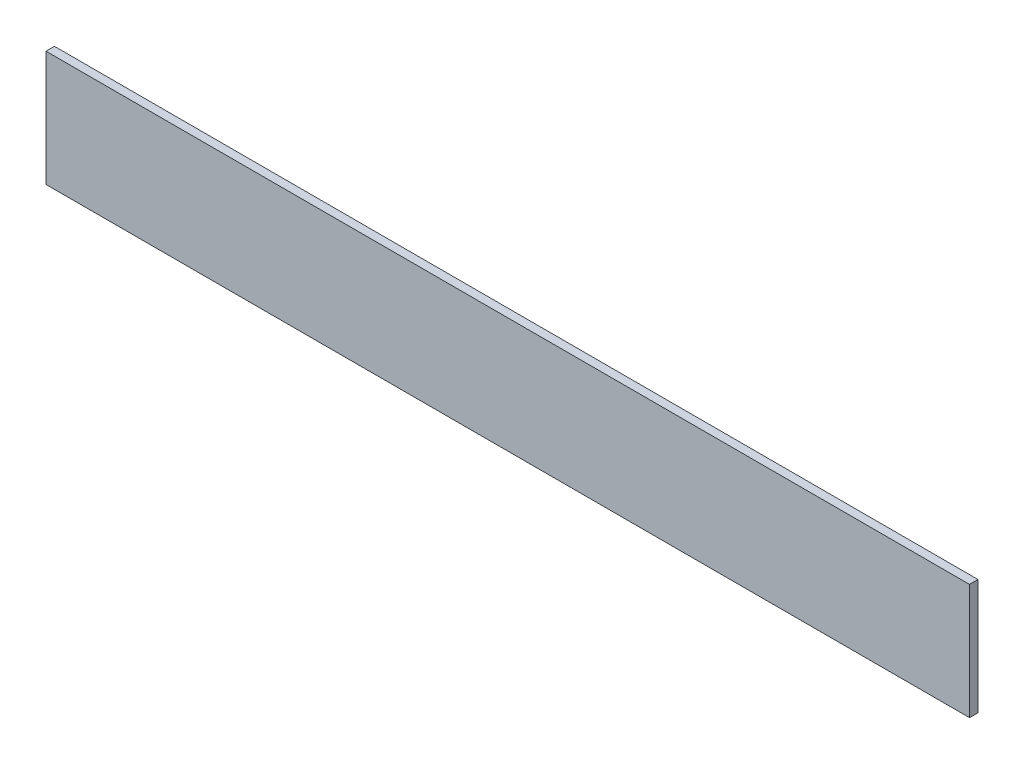
from build123d import *

# Parameters (mm, degrees)
SKETCH1_W           = 609.6
SKETCH1_H           = 76.2
BOSS_EXTRUDE1_DEPTH = 5.588


with BuildPart() as part:
    # Sketch1 → Boss-Extrude1 (new body)
    with BuildSketch(Plane.XY):
        with Locations((222.25, 19.05)):
            Rectangle(SKETCH1_W, SKETCH1_H)
    extrude(amount=BOSS_EXTRUDE1_DEPTH)


solid = part.part
